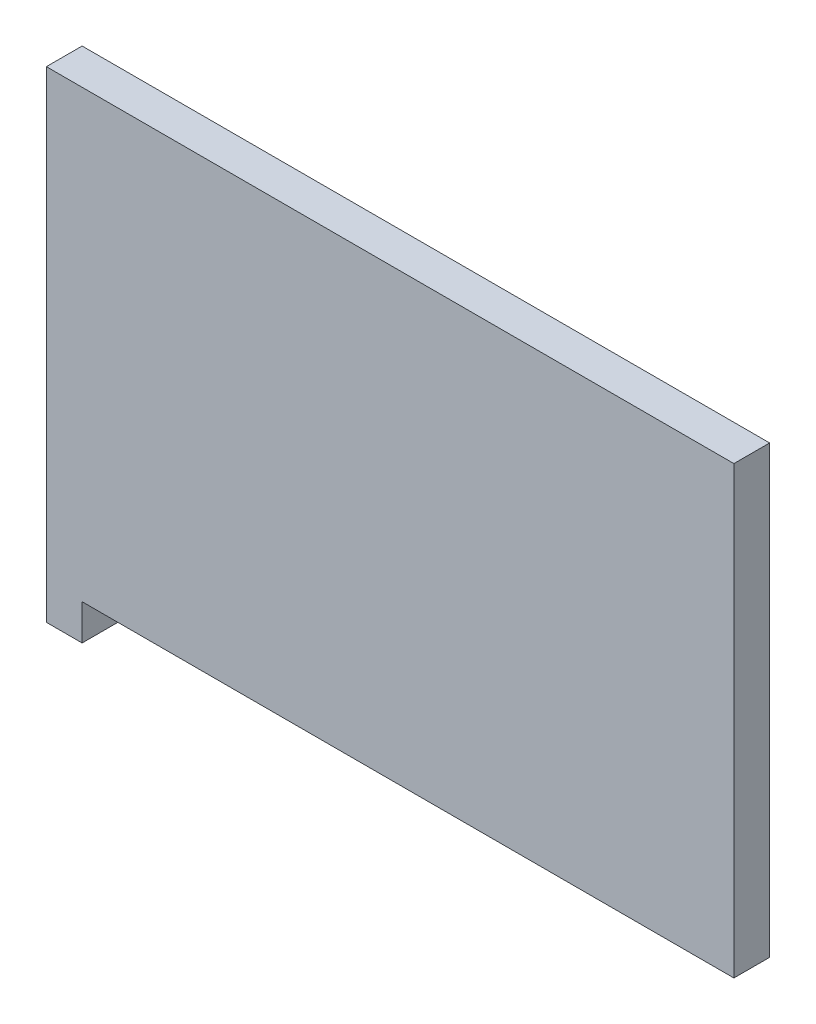
from build123d import *

# Parameters (mm, degrees)
SKETCH1_W           = 50
SKETCH1_H           = 35
BOSS_EXTRUDE1_DEPTH = 2.6
CAVITY1_OUTLINE_W   = 47.4
CAVITY1_OUTLINE_H   = 2.6
CAVITY1_DEPTH       = 2.6


# Read off the part's stored shape, not the designer's step: Cavity1
with BuildPart() as part:
    # Sketch1 → Boss-Extrude1 (new body)
    with BuildSketch(Plane.XY):
        with Locations((25, 17.5)):
            Rectangle(SKETCH1_W, SKETCH1_H)
    extrude(amount=BOSS_EXTRUDE1_DEPTH)

    # Cavity1 outline → Cavity1 (cut)
    with BuildSketch(Plane(origin=(0, 0, 0), x_dir=(1, 0, 0), z_dir=(0, 1, 0))):
        with Locations((26.3, -1.3)):
            Rectangle(CAVITY1_OUTLINE_W, CAVITY1_OUTLINE_H)
    extrude(amount=CAVITY1_DEPTH, mode=Mode.SUBTRACT)


solid = part.part
